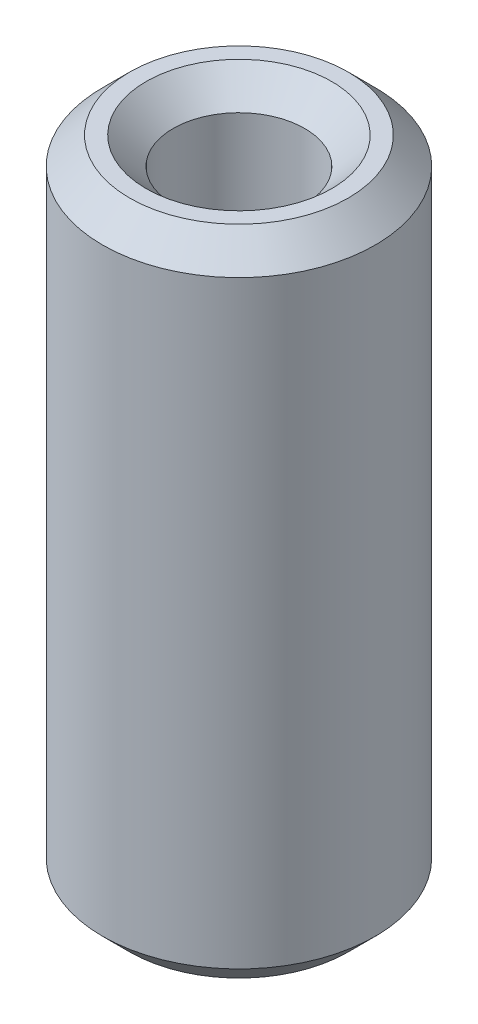
from build123d import *

# Parameters (mm, degrees)
SKETCH1_R           = 10
BOSS_EXTRUDE1_DEPTH = 47.893032842
SKETCH2_R           = 4.821979258
CUT_EXTRUDE1_DEPTH  = 50.937386744
CHAMFER1_SIZE       = 1.987363552


with BuildPart() as part:
    # Sketch1 → Boss-Extrude1 (new body)
    with BuildSketch(Plane(origin=(0, 0, 0), x_dir=(1, 0, 0), z_dir=(0, 1, 0))):
        Circle(SKETCH1_R)
    extrude(amount=BOSS_EXTRUDE1_DEPTH)

    # Sketch2 → Cut-Extrude1 (cut, through all)
    with BuildSketch(Plane(origin=(0, 0, 0), x_dir=(1, 0, 0), z_dir=(0, 1, 0))):
        Circle(SKETCH2_R)
    extrude(amount=CUT_EXTRUDE1_DEPTH, mode=Mode.SUBTRACT)

    # Chamfer1
    chamfer1_edges = [part.edges().sort_by_distance(p)[0] for p in [
        (-4.821979258, 47.893032842, 0),
        (-4.821979258, 0, 0),
        (-10, 0, 0),
        (-10, 47.893032842, 0),
    ]]
    chamfer(chamfer1_edges, length=CHAMFER1_SIZE)


solid = part.part
